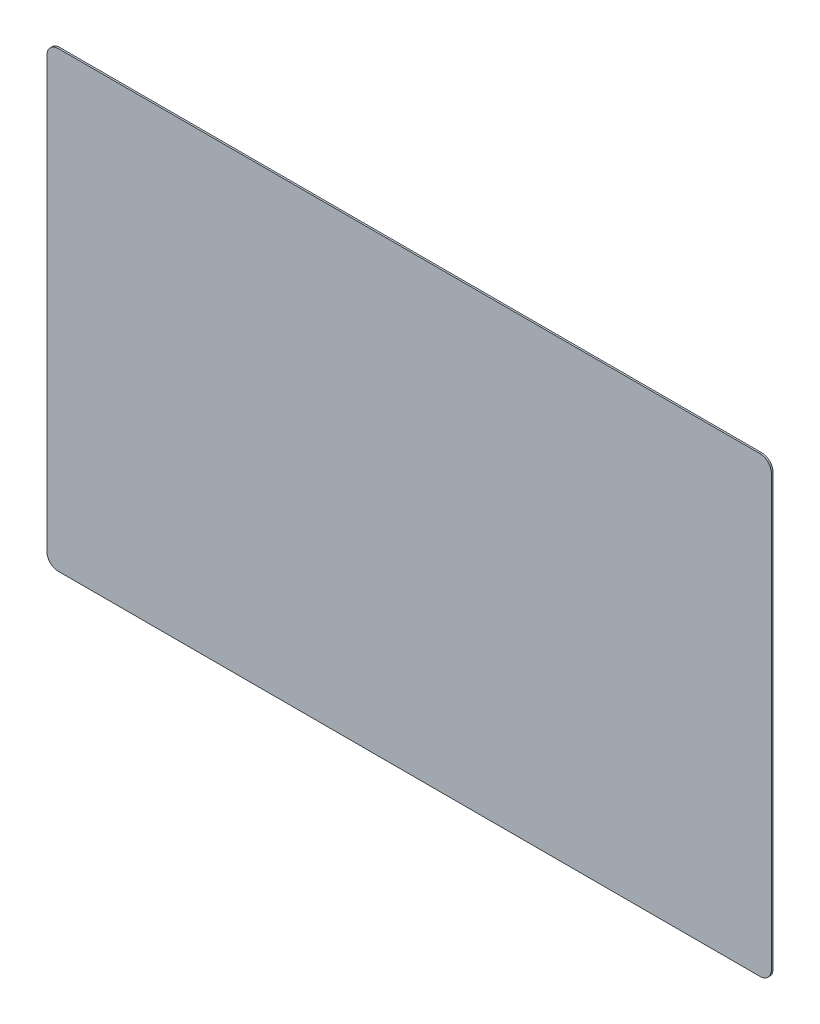
from build123d import *

# Parameters (mm, degrees)
SKETCH1_W          = 640
SKETCH1_H          = 400
BASE_FLANGE1_DEPTH = 1.5
FILLET1_R          = 10


# Sheet-metal steps are written as plain solids
with BuildPart() as part:
    # Sketch1 → Base-Flange1 (new body)
    with BuildSketch(Plane.XY):
        Rectangle(SKETCH1_W, SKETCH1_H)
    extrude(amount=-BASE_FLANGE1_DEPTH)

    # Fillet1
    fillet1_edges = [part.edges().sort_by_distance(p)[0] for p in [
        (-320, 200, -0.75),
        (320, 200, -0.75),
        (320, -200, -0.75),
        (-320, -200, -0.75),
    ]]
    fillet(fillet1_edges, radius=FILLET1_R)


solid = part.part
